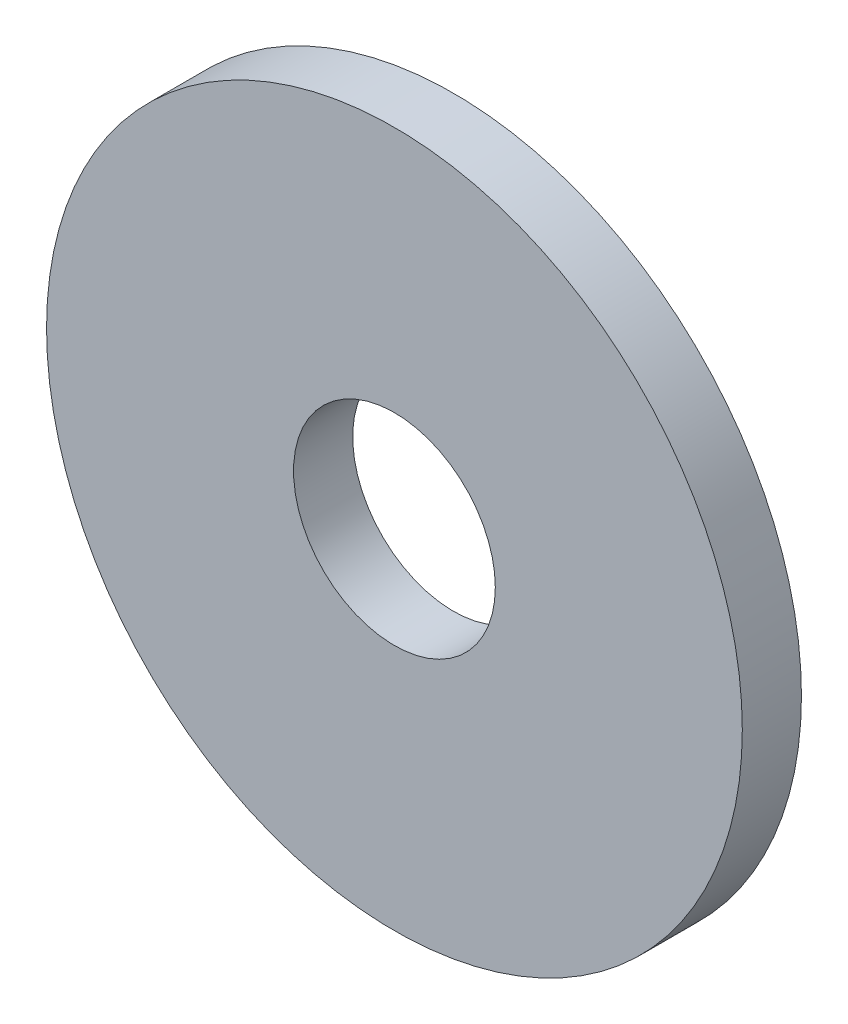
from build123d import *

# Parameters (mm, degrees)
SKETCH1_R           = 10
SKETCH1_R_2         = 2.9
BOSS_EXTRUDE1_DEPTH = 1.7


with BuildPart() as part:
    # Sketch1 → Boss-Extrude1 (new body)
    with BuildSketch(Plane.XY):
        Circle(SKETCH1_R)
        Circle(SKETCH1_R_2, mode=Mode.SUBTRACT)
    extrude(amount=BOSS_EXTRUDE1_DEPTH)


solid = part.part
